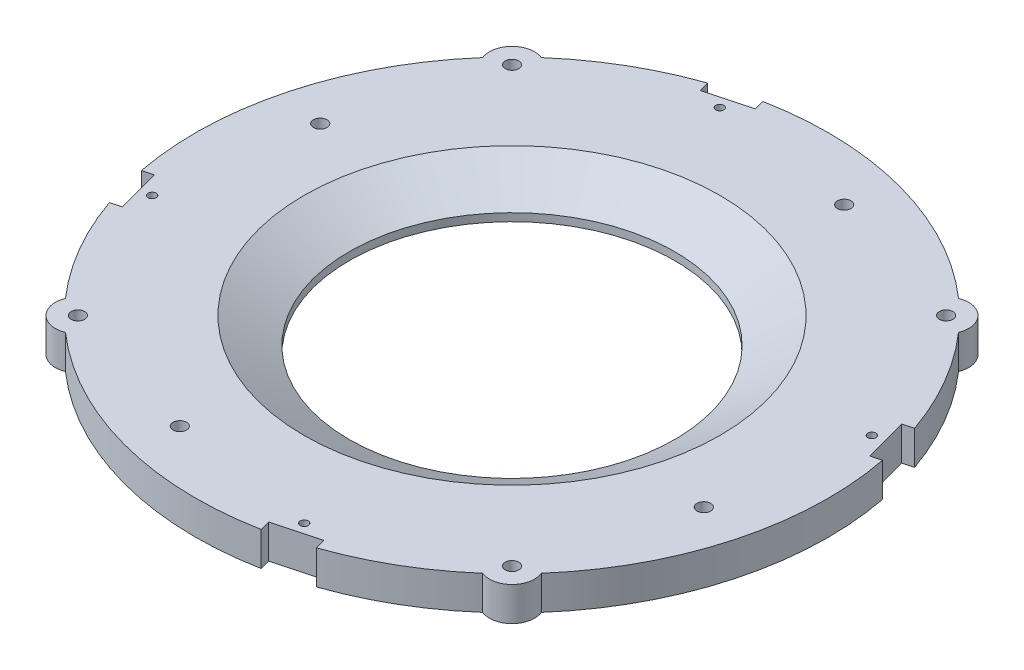
from build123d import *

# Parameters (mm, degrees)
SKETCH1_R           = 1.905
BOSS_EXTRUDE1_DEPTH = 9.525
SKETCH2_R           = 45.72
CUT_EXTRUDE1_DEPTH  = 12.7
SKETCH10_R          = 0.6985
CUT_EXTRUDE5_DEPTH  = 3.175
CIRPATTERN5_COUNT   = 4
CHAMFER1_SIZE       = 12.7
CHAMFER1_SIZE2      = 7.332348419
SKETCH4_R           = 1.905
CUT_EXTRUDE6_DEPTH  = 127.083883296
CIRPATTERN6_COUNT   = 4
SKETCH13_R          = 1.1303
CUT_EXTRUDE7_DEPTH  = 127.083883296
CIRPATTERN7_COUNT   = 4
SKETCH14_W          = 11.95230377
SKETCH14_H          = 12.7
CUT_EXTRUDE8_DEPTH  = 3.175
CIRPATTERN8_COUNT   = 4


with BuildPart() as part:
    # Sketch1 → Boss-Extrude1 (new body)
    with BuildSketch(Plane(origin=(0, 0, 0), x_dir=(1, 0, 0), z_dir=(0, 1, 0))):
        with BuildLine():
            ThreePointArc((-66.860826677, 58.590441679), (-88.9, 0), (-66.860826677, -58.590441679))
            ThreePointArc((-66.860826677, -58.590441679), (-65.466067123, -65.466067123), (-58.590441679, -66.860826677))
            ThreePointArc((-58.590441679, -66.860826677), (0, -88.9), (58.590441679, -66.860826677))
            ThreePointArc((58.590441679, -66.860826677), (65.466067123, -65.466067123), (66.860826677, -58.590441679))
            ThreePointArc((66.860826677, -58.590441679), (88.9, 0), (66.860826677, 58.590441679))
            ThreePointArc((66.860826677, 58.590441679), (65.466067123, 65.466067123), (58.590441679, 66.860826677))
            ThreePointArc((58.590441679, 66.860826677), (0, 88.9), (-58.590441679, 66.860826677))
            ThreePointArc((-58.590441679, 66.860826677), (-65.466067123, 65.466067123), (-66.860826677, 58.590441679))
        make_face()
        with Locations((-60.975939062, 60.975939062)):
            Circle(SKETCH1_R, mode=Mode.SUBTRACT)
        with Locations((60.975939062, 60.975939062)):
            Circle(SKETCH1_R, mode=Mode.SUBTRACT)
        with Locations((60.975939062, -60.975939062)):
            Circle(SKETCH1_R, mode=Mode.SUBTRACT)
        with Locations((-60.975939062, -60.975939062)):
            Circle(SKETCH1_R, mode=Mode.SUBTRACT)
    extrude(amount=BOSS_EXTRUDE1_DEPTH)

    # Sketch2 → Cut-Extrude1 (cut)
    with BuildSketch(Plane(origin=(0, 9.525, 0), x_dir=(1, 0, 0), z_dir=(0, 1, 0))):
        Circle(SKETCH2_R)
    extrude(amount=-CUT_EXTRUDE1_DEPTH, mode=Mode.SUBTRACT)

    # Sketch10 → Cut-Extrude5 (cut)
    with BuildSketch(Plane(origin=(-62.861792847, 0, -62.861792847), x_dir=(0, -1, 0), z_dir=(-0.7071067811865464, 0, -0.7071067811865488))):
        with Locations((-4.826, 0)):
            Circle(SKETCH10_R)
    cut_extrude5 = extrude(amount=-CUT_EXTRUDE5_DEPTH, mode=Mode.SUBTRACT)

    # CirPattern5: Cut-Extrude5 ×4 about axis
    cirpattern5_axis = Axis((0, 9.525, 0), (0, 1, 0))
    for i in range(1, CIRPATTERN5_COUNT):
        add(cut_extrude5.rotate(cirpattern5_axis, i * 360 / CIRPATTERN5_COUNT), mode=Mode.SUBTRACT)

    # Chamfer1
    chamfer1_edges = [part.edges().sort_by_distance(p)[0] for p in [
        (-45.72, 9.525, 0),
    ]]
    chamfer1_side = [part.faces().sort_by_distance(p)[0] for p in [
        (0, 9.525, -86.385528286),
    ]]
    chamfer(chamfer1_edges, length=CHAMFER1_SIZE, length2=CHAMFER1_SIZE2, reference=chamfer1_side[0])

    # Sketch4 → Cut-Extrude6 (cut, through all)
    with BuildSketch(Plane(origin=(0, 9.525, 0), x_dir=(1, 0, 0), z_dir=(0, 1, 0))):
        with Locations((19.722011237, 73.603547963)):
            Circle(SKETCH4_R)
    cut_extrude6 = extrude(amount=-CUT_EXTRUDE6_DEPTH, mode=Mode.SUBTRACT)

    # CirPattern6: Cut-Extrude6 ×4 about axis
    cirpattern6_axis = Axis((0, 9.525, 0), (0, 1, 0))
    for i in range(1, CIRPATTERN6_COUNT):
        add(cut_extrude6.rotate(cirpattern6_axis, i * 360 / CIRPATTERN6_COUNT), mode=Mode.SUBTRACT)

    # Sketch13 → Cut-Extrude7 (cut, through all)
    with BuildSketch(Plane(origin=(0, 9.525, 0), x_dir=(1, 0, 0), z_dir=(0, 1, 0))):
        with Locations((-21.365512173, 79.73717696)):
            Circle(SKETCH13_R)
    cut_extrude7 = extrude(amount=-CUT_EXTRUDE7_DEPTH, mode=Mode.SUBTRACT)

    # CirPattern7: Cut-Extrude7 ×4 about axis
    cirpattern7_axis = Axis((0, 9.525, 0), (0, 1, 0))
    for i in range(1, CIRPATTERN7_COUNT):
        add(cut_extrude7.rotate(cirpattern7_axis, i * 360 / CIRPATTERN7_COUNT), mode=Mode.SUBTRACT)

    # Sketch14 → Cut-Extrude8 (cut)
    with BuildSketch(Plane(origin=(-23.00901311, 0, -85.870805957), x_dir=(0, -1, 0), z_dir=(-0.25881904510251796, 0, -0.9659258262890691))):
        with Locations((-4.621692603, 0)):
            Rectangle(SKETCH14_W, SKETCH14_H)
    cut_extrude8 = extrude(amount=-CUT_EXTRUDE8_DEPTH, mode=Mode.SUBTRACT)

    # CirPattern8: Cut-Extrude8 ×4 about axis
    cirpattern8_axis = Axis((0, 9.525, 0), (0, 1, 0))
    for i in range(1, CIRPATTERN8_COUNT):
        add(cut_extrude8.rotate(cirpattern8_axis, i * 360 / CIRPATTERN8_COUNT), mode=Mode.SUBTRACT)


solid = part.part
